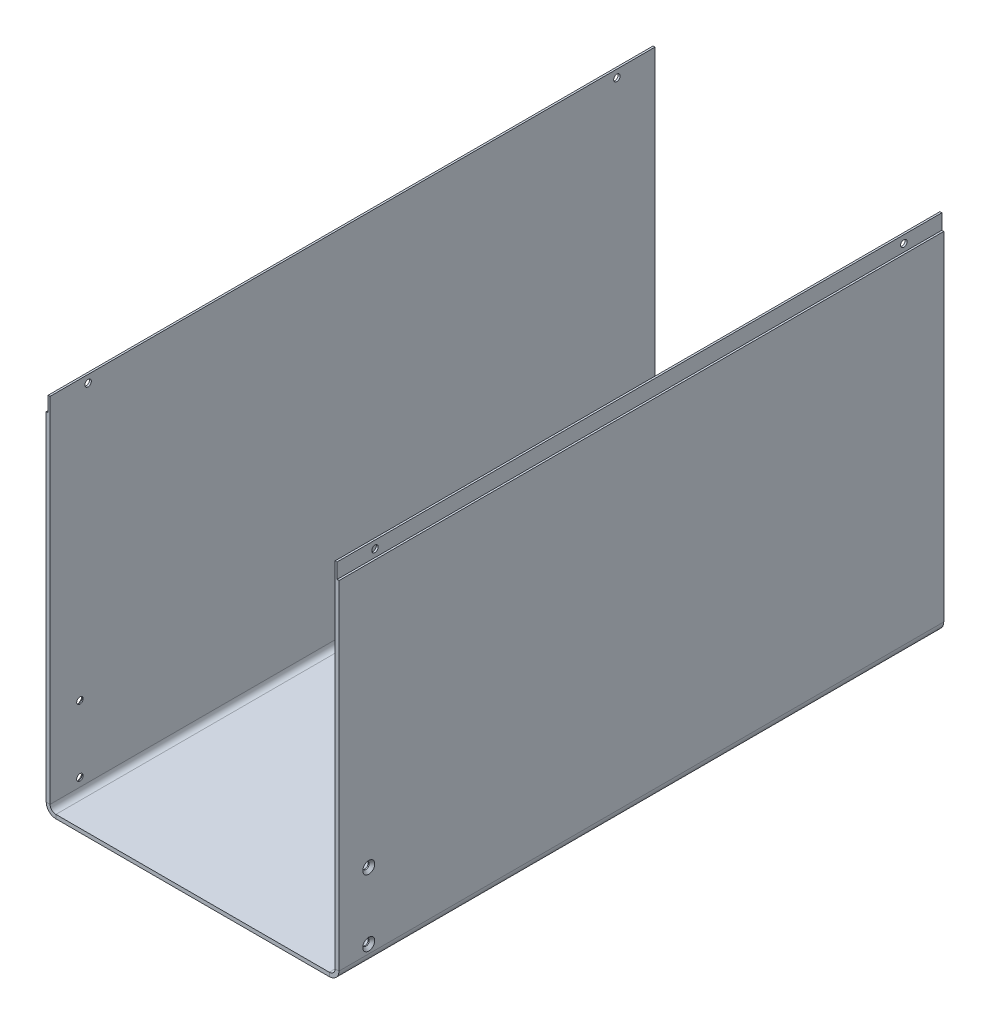
from build123d import *

# Parameters (mm, degrees)
SKETCH1_W                                      = 150
SKETCH1_H                                      = 318.3528
BASE_FLANGE1_DEPTH                             = 2.032
EDGE_FLANGE1_STRIP_W                           = 14.224
EDGE_FLANGE1_STRIP_H                           = 2.032
EDGE_FLANGE1_STRIP_CUT_DEPTH                   = 318.3528
EDGE_FLANGE1_STRIP_2_W                         = 14.224
EDGE_FLANGE1_STRIP_2_H                         = 2.032
EDGE_FLANGE1_STRIP_CUT_2_DEPTH                 = 318.3528
EDGE_FLANGE1_DEPTH                             = 318.3528
EDGE_FLANGE1_BEND_DEPTH                        = 318.3528
SKETCH9_W                                      = 318.3528
SKETCH9_H                                      = 8
CUT_EXTRUDE1_DEPTH                             = 1.016
SKETCH10_W                                     = 318.3528
SKETCH10_H                                     = 8
CUT_EXTRUDE3_DEPTH                             = 1.016
M3_CLEARANCE_HOLE1_D                           = 3.4
CSK_FOR_M3_FLAT_HEAD_MACHINE_SCREW1_AT_2_COUNT = 2
CSK_FOR_M3_FLAT_HEAD_MACHINE_SCREW1_AT_2_PITCH = 35
CSK_FOR_M3_FLAT_HEAD_MACHINE_SCREW2_AT_2_COUNT = 2
CSK_FOR_M3_FLAT_HEAD_MACHINE_SCREW2_AT_2_PITCH = 35


# Sheet-metal steps are written as plain solids
with BuildPart() as part:
    # Sketch1 → Base-Flange1 (new body)
    with BuildSketch(Plane(origin=(0, 0, 0), x_dir=(1, 0, 0), z_dir=(0, 1, 0))):
        with Locations((75, 159.1764)):
            Rectangle(SKETCH1_W, SKETCH1_H)
    extrude(amount=-BASE_FLANGE1_DEPTH)

    # Edge-Flange1 strip (across the edge) → Edge-Flange1 strip cut (cut)
    with BuildSketch(Plane(origin=(150, 0, 0), x_dir=(-1, 0, 0), z_dir=(0, 0, -1))):
        with Locations((-4.064, -1.016)):
            Rectangle(EDGE_FLANGE1_STRIP_W, EDGE_FLANGE1_STRIP_H)
    extrude(amount=EDGE_FLANGE1_STRIP_CUT_DEPTH, mode=Mode.SUBTRACT)

    # Edge-Flange1 strip 2 (across the edge) → Edge-Flange1 strip cut 2 (cut)
    with BuildSketch(Plane.XY.offset(-318.3528)):
        with Locations((-4.064, -1.016)):
            Rectangle(EDGE_FLANGE1_STRIP_2_W, EDGE_FLANGE1_STRIP_2_H)
    extrude(amount=EDGE_FLANGE1_STRIP_CUT_2_DEPTH, mode=Mode.SUBTRACT)

    # Edge-Flange1 section (across the edge) → Edge-Flange1 (add)
    with BuildSketch(Plane(origin=(150, 0, 0), x_dir=(-1, 0, 0), z_dir=(0, 0, -1))):
        with BuildLine():
            Line((-2.032, 3.048), (-2.032, 189.048))
            Line((-2.032, 189.048), (0, 189.048))
            Line((0, 189.048), (0, 3.048))
            ThreePointArc((0, 3.048), (0.892738531, 0.892738531), (3.048, 0))
            Line((3.048, 0), (3.048, -2.032))
            ThreePointArc((3.048, -2.032), (-0.544102448, -0.544102448), (-2.032, 3.048))
        make_face()
    extrude(amount=EDGE_FLANGE1_DEPTH)

    # Edge-Flange1 section 2 (across the edge) → Edge-Flange1 bend (add)
    with BuildSketch(Plane.XY.offset(-318.3528)):
        with BuildLine():
            Line((-2.032, 3.048), (-2.032, 189.048))
            Line((-2.032, 189.048), (0, 189.048))
            Line((0, 189.048), (0, 3.048))
            ThreePointArc((0, 3.048), (0.892738531, 0.892738531), (3.048, 0))
            Line((3.048, 0), (3.048, -2.032))
            ThreePointArc((3.048, -2.032), (-0.544102448, -0.544102448), (-2.032, 3.048))
        make_face()
    extrude(amount=EDGE_FLANGE1_BEND_DEPTH)

    # Sketch9 → Cut-Extrude1 (cut)
    with BuildSketch(Plane(origin=(152.032, 0, 0), x_dir=(0, 0, -1), z_dir=(1, 0, 0))):
        with Locations((159.1764, 185.048)):
            Rectangle(SKETCH9_W, SKETCH9_H)
    extrude(amount=-CUT_EXTRUDE1_DEPTH, mode=Mode.SUBTRACT)

    # Sketch10 → Cut-Extrude3 (cut)
    with BuildSketch(Plane(origin=(-2.032, 0, -3.175), x_dir=(0, 0, -1), z_dir=(1, 0, 0))):
        with Locations((156.0014, 185.048)):
            Rectangle(SKETCH10_W, SKETCH10_H)
    extrude(amount=CUT_EXTRUDE3_DEPTH, mode=Mode.SUBTRACT)

    # M3 Clearance Hole1 (through all)
    with Locations(Plane(origin=(151.016, 0, 0), x_dir=(0, 0, -1), z_dir=(1, 0, 0))):
        with Locations((20.003324657, 185.048), (298.3528, 185.048)):
            Hole(M3_CLEARANCE_HOLE1_D / 2)

    # Sketch20 → CSK for M3 Flat Head Machine Screw1 (revolve, cut)
    with BuildSketch(Plane(origin=(152.032, 42.5, -15.7004), x_dir=(0, 0, -1), z_dir=(0, 1, 0))):
        Polygon((0, 0), (0, 2.032), (1.7, 2.032), (1.7, 1.45), (3.15, 0), align=None)
    csk_for_m3_flat_head_machine_screw1 = revolve(axis=Axis((158.382, 42.5, -15.7004), (-1, 0, 0)), mode=Mode.SUBTRACT)

    # CSK for M3 Flat Head Machine Screw1 at 2: CSK for M3 Flat Head Machine Screw1 ×2
    with Locations(*[(0, -i * CSK_FOR_M3_FLAT_HEAD_MACHINE_SCREW1_AT_2_PITCH, 0) for i in range(1, CSK_FOR_M3_FLAT_HEAD_MACHINE_SCREW1_AT_2_COUNT)]):
        add(csk_for_m3_flat_head_machine_screw1, mode=Mode.SUBTRACT)

    # Sketch23 → CSK for M3 Flat Head Machine Screw2 (revolve, cut)
    with BuildSketch(Plane(origin=(-2.032, 42.5, -15.7004), x_dir=(0, 0, 1), z_dir=(0, 1, 0))):
        Polygon((0, 0), (0, 2.032), (1.7, 2.032), (1.7, 1.45), (3.15, 0), align=None)
    csk_for_m3_flat_head_machine_screw2 = revolve(axis=Axis((-8.382, 42.5, -15.7004), (1, 0, 0)), mode=Mode.SUBTRACT)

    # CSK for M3 Flat Head Machine Screw2 at 2: CSK for M3 Flat Head Machine Screw2 ×2
    with Locations(*[(0, -i * CSK_FOR_M3_FLAT_HEAD_MACHINE_SCREW2_AT_2_PITCH, 0) for i in range(1, CSK_FOR_M3_FLAT_HEAD_MACHINE_SCREW2_AT_2_COUNT)]):
        add(csk_for_m3_flat_head_machine_screw2, mode=Mode.SUBTRACT)


solid = part.part
